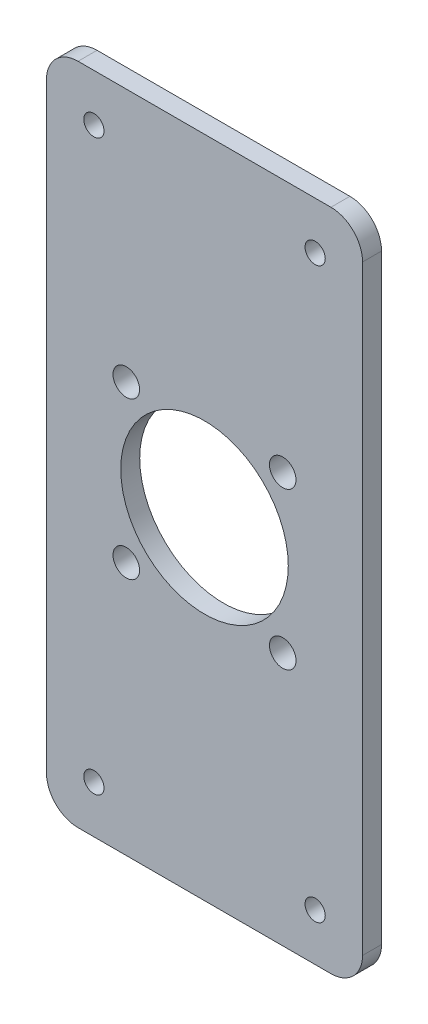
from build123d import *

# Parameters (mm, degrees)
SKETCH_2_W      = 50
SKETCH_2_H      = 105
SKETCH_2_R      = 13.25
SKETCH_2_R_2    = 1.6
SKETCH_2_R_3    = 2.1
EXTRUDE_1_DEPTH = 3
FILLET_1_R      = 5


with BuildPart() as part:
    # ｽｹｯﾁ2 → ﾎﾞｽ - 押し出し1 (new body)
    with BuildSketch(Plane.XY):
        with Locations((25, 52.5)):
            Rectangle(SKETCH_2_W, SKETCH_2_H)
        with Locations((25, 52.5)):
            Circle(SKETCH_2_R, mode=Mode.SUBTRACT)
        with Locations((7.5, 97.5)):
            Circle(SKETCH_2_R_2, mode=Mode.SUBTRACT)
        with Locations((42.5, 97.5)):
            Circle(SKETCH_2_R_2, mode=Mode.SUBTRACT)
        with Locations((42.5, 7.5)):
            Circle(SKETCH_2_R_2, mode=Mode.SUBTRACT)
        with Locations((7.5, 7.5)):
            Circle(SKETCH_2_R_2, mode=Mode.SUBTRACT)
        with Locations((37.374368671, 64.874368671)):
            Circle(SKETCH_2_R_3, mode=Mode.SUBTRACT)
        with Locations((12.625631329, 64.874368671)):
            Circle(SKETCH_2_R_3, mode=Mode.SUBTRACT)
        with Locations((37.374368671, 40.125631329)):
            Circle(SKETCH_2_R_3, mode=Mode.SUBTRACT)
        with Locations((12.625631329, 40.125631329)):
            Circle(SKETCH_2_R_3, mode=Mode.SUBTRACT)
    extrude(amount=EXTRUDE_1_DEPTH)

    # ﾌｨﾚｯﾄ1
    fillet_1_edges = [part.edges().sort_by_distance(p)[0] for p in [
        (0, 0, 1.5),
        (50, 0, 1.5),
        (0, 105, 1.5),
        (50, 105, 1.5),
    ]]
    fillet(fillet_1_edges, radius=FILLET_1_R)


solid = part.part
